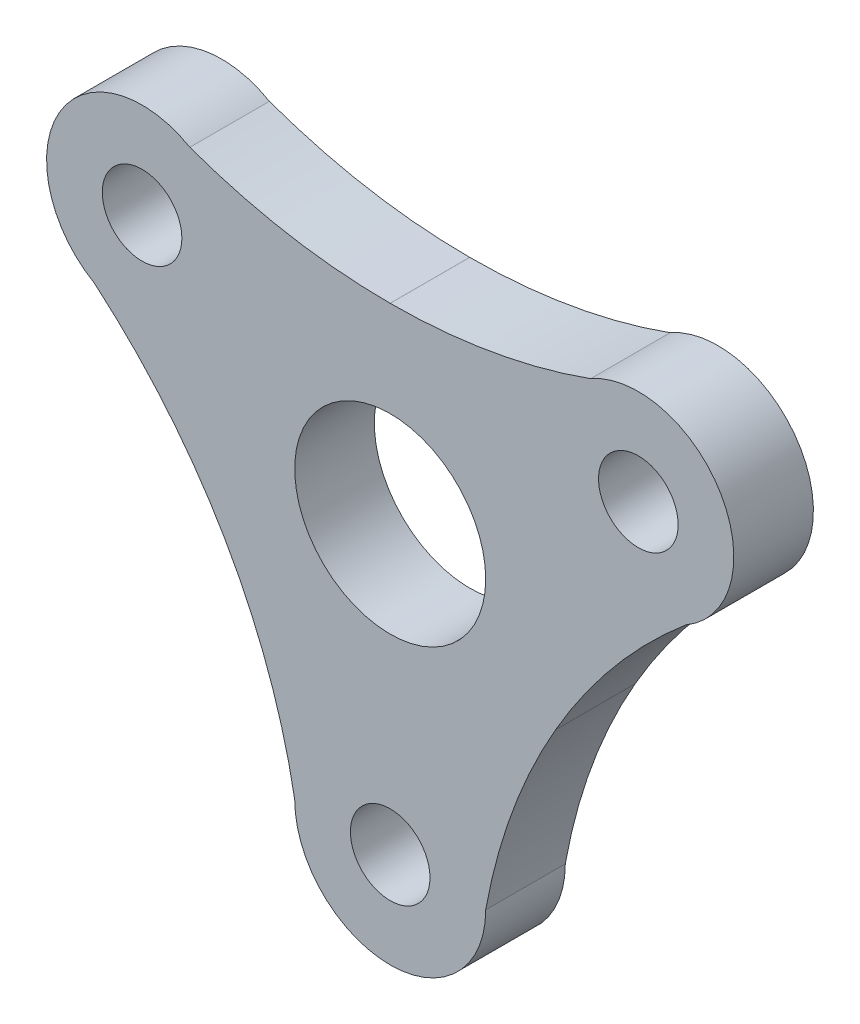
from build123d import *

# Parameters (mm, degrees)
ESBO_O1_R                 = 24
ESBO_O1_R_2               = 6
RESSALTO_EXTRUS_O1_DEPTH  = 5
ESBO_O2_R                 = 2.5
CORTE_EXTRUS_O1_DEPTH     = 45.905785333
CORTE_EXTRUS_O2_START     = -5
CORTE_EXTRUS_O2_OUTLINE_R = 2.5
CORTE_EXTRUS_O2_DEPTH     = 5


# Read off the part's stored shape, not the designer's step: Corte-extrusão2
with BuildPart() as part:
    # Esboço1 → Ressalto-extrusão1 (new body)
    with BuildSketch(Plane.XY):
        with Locations((4.905528128, 10)):
            Circle(ESBO_O1_R)
        with Locations((4.905528128, 10)):
            Circle(ESBO_O1_R_2, mode=Mode.SUBTRACT)
    extrude(amount=RESSALTO_EXTRUS_O1_DEPTH)

    # Esboço2 → Corte-extrusão1 (cut, through all)
    with BuildSketch(Plane.XY.offset(5)):
        with Locations((4.905528128, 28)):
            Circle(ESBO_O2_R)
        with Locations((20.493985396, 19)):
            Circle(ESBO_O2_R)
        with Locations((20.493985396, 1)):
            Circle(ESBO_O2_R)
        with Locations((4.905528128, -8)):
            Circle(ESBO_O2_R)
        with Locations((-10.68292914, 1)):
            Circle(ESBO_O2_R)
        with Locations((-10.68292914, 19)):
            Circle(ESBO_O2_R)
    extrude(amount=-CORTE_EXTRUS_O1_DEPTH, mode=Mode.SUBTRACT)

    # Corte-extrusão2 outline → Corte-extrusão2 (cut)
    # profile 1 of 3: a face of its own
    with BuildSketch(Plane.XY.offset(5).offset(CORTE_EXTRUS_O2_START)):
        with BuildLine():
            ThreePointArc((4.897969025, 21.999997619), (4.901748576, 21.999999405), (4.905528128, 22))
            ThreePointArc((4.905528128, 22), (11.295284197, 22.550508098), (17.493985396, 24.196152423))
            ThreePointArc((17.493985396, 24.196152423), (22.046899667, 24.795554958), (25.690137819, 22))
            ThreePointArc((25.690137819, 22), (4.905528128, 34), (-15.879081563, 22))
            ThreePointArc((-15.879081563, 22), (-12.235843411, 24.795554958), (-7.68292914, 24.196152423))
            ThreePointArc((-7.68292914, 24.196152423), (-1.487951224, 22.551157849), (4.897969025, 21.999997619))
        make_face()
        with Locations((4.905528128, 28)):
            Circle(CORTE_EXTRUS_O2_OUTLINE_R, mode=Mode.SUBTRACT)
    # profile 2 of 3: a face of its own
    with BuildSketch(Plane.XY.offset(5).offset(CORTE_EXTRUS_O2_START)):
        with BuildLine():
            ThreePointArc((4.905528128, -14), (25.690137819, -2), (25.690137819, 22))
            ThreePointArc((25.690137819, 22), (26.289540354, 17.447085729), (23.493985396, 13.803847577))
            ThreePointArc((23.493985396, 13.803847577), (18.971889348, 9.261336613), (15.301607732, 4.006549141))
            ThreePointArc((15.301607732, 4.006549141), (15.299722234, 4.003273486), (15.297832974, 4))
            ThreePointArc((15.297832974, 4), (12.579708936, -1.808945129), (10.905528128, -8))
            ThreePointArc((10.905528128, -8), (9.148168815, -12.242640687), (4.905528128, -14))
        make_face()
        with Locations((20.493985396, 1)):
            Circle(CORTE_EXTRUS_O2_OUTLINE_R, mode=Mode.SUBTRACT)
    # profile 3 of 3: a face of its own
    with BuildSketch(Plane.XY.offset(5).offset(CORTE_EXTRUS_O2_START)):
        with BuildLine():
            ThreePointArc((-13.68292914, 13.803847577), (-16.478484098, 17.447085729), (-15.879081563, 22))
            ThreePointArc((-15.879081563, 22), (-15.879081563, -2), (4.905528128, -14))
            ThreePointArc((4.905528128, -14), (0.662887441, -12.242640687), (-1.094471872, -8))
            ThreePointArc((-1.094471872, -8), (-2.76865268, -1.808945129), (-5.486776717, 4))
            ThreePointArc((-5.486776717, 4), (-5.488665978, 4.003273485), (-5.490554207, 4.006547566))
            ThreePointArc((-5.490554207, 4.006547566), (-9.160833092, 9.261336613), (-13.68292914, 13.803847577))
        make_face()
        with Locations((-10.68292914, 1)):
            Circle(CORTE_EXTRUS_O2_OUTLINE_R, mode=Mode.SUBTRACT)
    extrude(amount=CORTE_EXTRUS_O2_DEPTH, mode=Mode.SUBTRACT)


solid = part.part
